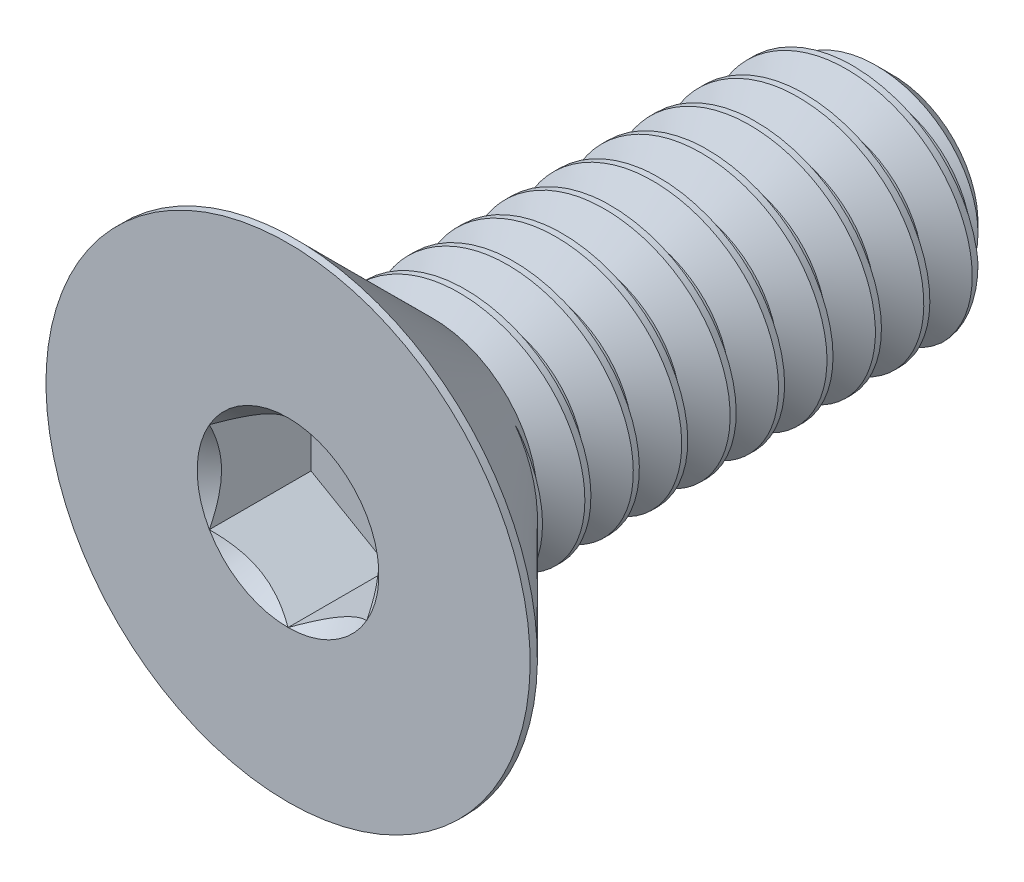
from build123d import *

# Parameters (mm, degrees)
CHAMFER1_SIZE      = 0.3
CUT_EXTRUDE2_DEPTH = 0.84
CUT_SWEEP1_PITCH   = 0.4
CUT_SWEEP1_TO      = 4.16


with BuildPart() as part:
    # Sketch1 → Revolve1 (revolve)
    with BuildSketch(Plane(origin=(0, 0, 0), x_dir=(0, 0, -1), z_dir=(1, 0, 0)), mode=Mode.PRIVATE) as revolve1_sk:
        Polygon((-1.3, 1), (2.5, 1), (2.5, 0), (-1.66, 0), (-1.66, 1), align=None)
    revolve(revolve1_sk.sketch.rotate(Axis((0, 0, 1.66), (0, 0, -1)), 180), axis=Axis((0, 0, 1.66), (0, 0, -1)))

    # Chamfer1
    chamfer1_edges = [part.edges().sort_by_distance(p)[0] for p in [
        (0, 1, -2.5),
    ]]
    chamfer(chamfer1_edges, length=CHAMFER1_SIZE)

    # Cut-Sweep1: arcs per turn and ends read off the stored shape
    # Cut-Sweep1: the profile of Sketch13 screwed along a right-hand helix through 12.5 turns, 6 arcs to a turn; built about Z, then put on its axis
    cut_sweep1_z = Axis((0, 0, 0), (0, 0, 1))
    cut_sweep1_corners = [(1.021650635, 0, 0.0125), (1.021650635, 0, -0.3625), (0.740192379, 0, -0.2), (0.740192379, 0, -0.15)]
    with BuildLine(mode=Mode.PRIVATE) as cut_sweep1_profile:
        Line(cut_sweep1_corners[0], cut_sweep1_corners[1])
        Line(cut_sweep1_corners[1], cut_sweep1_corners[2])
        Line(cut_sweep1_corners[2], cut_sweep1_corners[3])
        Line(cut_sweep1_corners[3], cut_sweep1_corners[0])
    cut_sweep1_cap = Face(cut_sweep1_profile.wire())
    cut_sweep1_turn_angles = [0, 30, 60, 90, 120, 150, 180, 210, 240, 270, 300, 330, 360]
    cut_sweep1_turn_weights = [1, 0.8660254037844387, 1, 0.8660254037844387, 1, 0.8660254037844387, 1, 0.8660254037844387, 1, 0.8660254037844387, 1, 0.8660254037844387, 1]
    cut_sweep1_turn_rails = [Edge.make_bspline([Vector(p[0], p[1], 0).rotate(cut_sweep1_z, cut_sweep1_turn_angles[k]) / cut_sweep1_turn_weights[k] + Vector(0, 0, p[2] + CUT_SWEEP1_PITCH * cut_sweep1_turn_angles[k] / 360) for k in range(13)], [0, 0, 0, 1, 1, 2, 2, 3, 3, 4, 4, 5, 5, 6, 6, 6], 2, cut_sweep1_turn_weights) for p in cut_sweep1_corners]
    cut_sweep1_turn_sides = [Face.make_surface_from_curves(cut_sweep1_turn_rails[p[0]], cut_sweep1_turn_rails[p[1]]) for p in [(0, 1), (1, 2), (2, 3), (3, 0)]]
    cut_sweep1_last_angles = [4320, 4350, 4380, 4410, 4440, 4470, 4500]
    cut_sweep1_last_weights = [1, 0.8660254037844387, 1, 0.8660254037844387, 1, 0.866025403784399, 1]
    cut_sweep1_last_rails = [Edge.make_bspline([Vector(p[0], p[1], 0).rotate(cut_sweep1_z, cut_sweep1_last_angles[k]) / cut_sweep1_last_weights[k] + Vector(0, 0, p[2] + CUT_SWEEP1_PITCH * cut_sweep1_last_angles[k] / 360) for k in range(7)], [0, 0, 0, 1, 1, 2, 2, 3, 3, 3], 2, cut_sweep1_last_weights) for p in cut_sweep1_corners]
    cut_sweep1_last_sides = [Face.make_surface_from_curves(cut_sweep1_last_rails[p[0]], cut_sweep1_last_rails[p[1]]) for p in [(0, 1), (1, 2), (2, 3), (3, 0)]]
    cut_sweep1 = Plane(origin=(0, 0, -2.5), x_dir=(0, 1, 0), z_dir=(0, 0, 1)) * split(Solid(Shell([*[p.moved(Location((0, 0, CUT_SWEEP1_PITCH * i))) for i in range(12) for p in cut_sweep1_turn_sides], *cut_sweep1_last_sides, cut_sweep1_cap, cut_sweep1_cap.rotate(cut_sweep1_z, 4500).moved(Location((0, 0, CUT_SWEEP1_PITCH * 4500 / 360)))])), bisect_by=Plane.XY.offset(CUT_SWEEP1_TO), keep=Keep.BOTTOM, mode=Mode.PRIVATE)
    add(cut_sweep1, mode=Mode.SUBTRACT)


with BuildPart() as body_2:
    # Sketch7 → Revolve2 (revolve)
    with BuildSketch(Plane(origin=(0, 0, 0), x_dir=(0, 0, -1), z_dir=(1, 0, 0)), mode=Mode.PRIVATE) as revolve2_sk:
        Polygon((-2.5, 2), (-2.44, 2), (-1.3, 0.86), (-1.3, 0), (-2.5, 0), align=None)
    revolve(revolve2_sk.sketch.rotate(Axis((0, 0, 2.5), (0, 0, -1)), 180), axis=Axis((0, 0, 2.5), (0, 0, -1)))

    # Sketch5 → Cut-Extrude2 (cut)
    with BuildSketch(Plane.XY.offset(2.5)):
        Polygon((0.65, -0.375277675), (0.65, 0.375277675), (0, 0.75055535), (-0.65, 0.375277675), (-0.65, -0.375277675), (0, -0.75055535), align=None)
    extrude(amount=-CUT_EXTRUDE2_DEPTH, mode=Mode.SUBTRACT)

    # Cut-Extrude3 cone 1 section (through the dimple's axis) → Cut-Extrude3 (revolve, cut)
    with BuildSketch(Plane(origin=(0, 0, 2.5), x_dir=(0, -1, 0), z_dir=(1, 0, 0))):
        Polygon((0, 0), (0.75055535, 0), (0, 0.75055535), align=None)
    revolve(axis=Axis((0, 0, 2.5), (0, 0, -1)), mode=Mode.SUBTRACT)

    # Combine1: union part
    add(part.part)


solid = body_2.part
